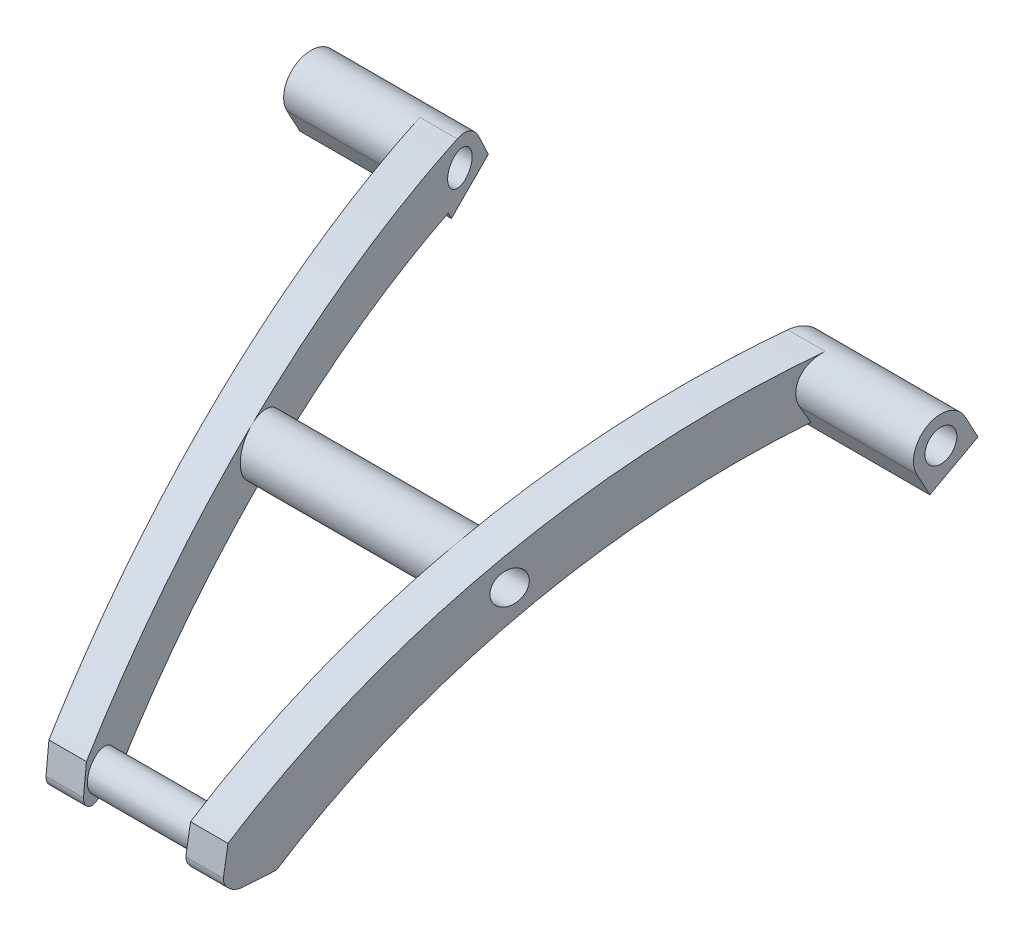
from build123d import *

# Parameters (mm, degrees)
CROQUIS3_R                        = 3
CROQUIS3_R_2                      = 1.75
SALIENTE_EXTRUIR1_DEPTH           = 25
SALIENTE_EXTRUIR1_2_DEPTH         = 25
SALIENTE_EXTRUIR2_DEPTH           = 5
CROQUIS6_R                        = 3
SALIENTE_EXTRUIR3_DEPTH           = 10
CROQUIS7_R                        = 1.75
CORTAR_EXTRUIR1_DEPTH             = 10
SALIENTE_EXTRUIR4_DEPTH           = 35
SALIENTE_EXTRUIR4_DEPTH_BACK      = 4
CORTAR_EXTRUIR2_DEPTH             = 35
CORTAR_EXTRUIR3_DEPTH             = 35
CROQUIS11_R                       = 1.75
CORTAR_EXTRUIR4_DEPTH             = 75.850885973
CHAFL_N1_SIZE                     = 2
REDONDEO2_START                   = -5.0000001
REDONDEO2_DEPTH                   = 10.0000002
CROQUIS15_R                       = 3
CROQUIS15_R_2                     = 1.75
SALIENTE_EXTRUIR7_DEPTH           = 34.5
CORTAR_EXTRUIR6_DEPTH             = 75.850885889
CROQUIS17_W                       = 58.035388513
CROQUIS17_H                       = 46.523798752
CORTAR_EXTRUIR7_DEPTH             = 89.512139195
CROQUIS18_W                       = 44.423903472
CROQUIS18_H                       = 36.103655843
CORTAR_EXTRUIR8_DEPTH             = 69.319773447
CORTAR_EXTRUIR9_REACH             = 58.506
CROQUIS19_W                       = 12.504575714
CROQUIS19_H                       = 15.8167713
CORTAR_EXTRUIR9_DIRECTION_2_REACH = 58.506
CORTAR_EXTRUIR10_DEPTH            = 57.505797104
CORTAR_EXTRUIR10_DEPTH_BACK       = 57.505797104
SALIENTE_EXTRUIR8_START           = 5.604429129
SALIENTE_EXTRUIR8_DEPTH           = 5.209978082
SALIENTE_EXTRUIR8_START_2         = 9
SALIENTE_EXTRUIR8_2_OUTLINE_W     = 8
SALIENTE_EXTRUIR8_2_OUTLINE_H     = 9
SALIENTE_EXTRUIR8_2_DEPTH         = 2.244792929
SALIENTE_EXTRUIR8_START_3         = 15.244792929
SALIENTE_EXTRUIR8_3_OUTLINE_W     = 8
SALIENTE_EXTRUIR8_3_OUTLINE_H     = 9
SALIENTE_EXTRUIR8_3_DEPTH         = 1.755207071
SALIENTE_EXTRUIR9_REACH           = 58.506
CROQUIS27_R                       = 2
SALIENTE_EXTRUIR10_REACH          = 84.241


with BuildPart() as part:
    # Croquis3 → Saliente-Extruir1 (new body)
    with BuildSketch(Plane(origin=(0, 0, 0), x_dir=(0, 0, -1), z_dir=(1, 0, 0))):
        with Locations((0, 20.2)):
            Circle(CROQUIS3_R)
        with Locations((0, 20.2)):
            Circle(CROQUIS3_R_2, mode=Mode.SUBTRACT)
    extrude(amount=SALIENTE_EXTRUIR1_DEPTH)


with BuildPart() as body_2:
    # Croquis3 → Saliente-Extruir1 2 (new body)
    with BuildSketch(Plane(origin=(0, 0, 0), x_dir=(0, 0, -1), z_dir=(1, 0, 0))):
        with Locations((28.402251252, 28.88343963)):
            Circle(CROQUIS3_R)
        with Locations((28.402251252, 28.88343963)):
            Circle(CROQUIS3_R_2, mode=Mode.SUBTRACT)
    extrude(amount=SALIENTE_EXTRUIR1_2_DEPTH)


with BuildPart() as body_3:
    # Croquis5 → Saliente-Extruir2 (new, symmetric)
    with BuildSketch(Plane(origin=(0, 0, 0), x_dir=(1, 0, 0), z_dir=(0, 1, 0))):
        with BuildLine():
            Line((0, -26), (0, -30))
            add(Edge.make_bspline(
                [(0, -30), (3.306526268, -30), (16.53263134, -29.831217065), (35.997648536, -28.565345051), (52.057120801, -26.333176426), (58.766277483, -25.109762555), (60, -24.873829164)],
                knots=[4.71238898, 4.71238898, 4.71238898, 4.71238898, 4.810563751, 5.105088062, 5.301437603, 5.346535107, 5.346535107, 5.346535107, 5.346535107], degree=3))
            Line((60, -24.873829164), (60, -20.8))
            add(Edge.make_bspline(
                [(0, -26), (33.333333333, -26), (60, -20.8)],
                knots=[4.71238898, 4.71238898, 4.71238898, 5.355890089, 5.355890089, 5.355890089], degree=2, weights=[1, 0.948683298, 1]))
        make_face()
    extrude(amount=SALIENTE_EXTRUIR2_DEPTH, both=True)

    # Croquis6 → Saliente-Extruir3 (add)
    with BuildSketch(Plane.XY.offset(26)):
        with Locations((38, 0)):
            Circle(CROQUIS6_R)
    extrude(amount=-SALIENTE_EXTRUIR3_DEPTH)

    # Croquis7 → Cortar-Extruir1 (cut)
    with BuildSketch(Plane(origin=(0, 0, 16), x_dir=(-1, 0, 0), z_dir=(0, 0, -1))):
        with Locations((-38, 0)):
            Circle(CROQUIS7_R)
    extrude(amount=-CORTAR_EXTRUIR1_DEPTH, mode=Mode.SUBTRACT)


with BuildPart() as body_4:
    # Croquis8 → Saliente-Extruir4 (new, two sides: drawn at the far end of the back side and taken through both)
    with BuildSketch(Plane(origin=(0, 0, 0), x_dir=(1, 0, 0), z_dir=(0, 1, 0)).offset(-SALIENTE_EXTRUIR4_DEPTH_BACK)):
        Polygon((18.892070983, 31.402251252), (5, -28), (9.107929017, -28), (23, 31.402251252), align=None)
    extrude(amount=SALIENTE_EXTRUIR4_DEPTH + SALIENTE_EXTRUIR4_DEPTH_BACK)

    # Croquis9 → Cortar-Extruir2 (cut)
    with BuildSketch(Plane(origin=(0, 0, 0), x_dir=(0, 0, -1), z_dir=(1, 0, 0))):
        with BuildLine():
            ThreePointArc((23.072173604, 71.551815183), (-21.61922461, 57.42408075), (-58.358460899, 28.318368742))
            ThreePointArc((-58.358460899, 28.318368742), (-54.318368742, -32.358460899), (6.358460899, -28.318368742))
            ThreePointArc((6.358460899, -28.318368742), (18.708788399, -18.534140443), (33.7323289, -13.784935922))
            ThreePointArc((33.7323289, -13.784935922), (71.070626804, 34.213517278), (23.072173604, 71.551815183))
        make_face()
        with BuildLine():
            ThreePointArc((28.03038537, 31.860303041), (-2.862009257, 22.094675544), (-28.257567039, 1.975700145))
            ThreePointArc((-28.257567039, 1.975700145), (-27.975700145, -2.257567039), (-23.742432961, -1.975700145))
            ThreePointArc((-23.742432961, -1.975700145), (-0.048426954, 16.795264763), (28.774117135, 25.90657622))
            ThreePointArc((28.774117135, 25.90657622), (31.379114663, 29.255305513), (28.03038537, 31.860303041))
        make_face(mode=Mode.SUBTRACT)
    extrude(amount=CORTAR_EXTRUIR2_DEPTH, mode=Mode.SUBTRACT)


with BuildPart() as cortar_extruir3_tool:
    # Croquis10 → Cortar-Extruir3 (new body)
    with BuildSketch(Plane(origin=(0, 0, 0), x_dir=(1, 0, 0), z_dir=(0, 1, 0))):
        Polygon((14.368051869, -5.50780718), (23.738120218, 34.558440326), (28.571984955, 34.558440326), (28.571984955, -5.50780718), align=None)
    extrude(amount=CORTAR_EXTRUIR3_DEPTH)


with BuildPart() as part_1:
    add(part.part)

    # Cortar-Extruir3: cut by cortar_extruir3_tool
    add(cortar_extruir3_tool.part, mode=Mode.SUBTRACT)


with BuildPart() as body_2_1:
    add(body_2.part)

    # Cortar-Extruir3: cut by cortar_extruir3_tool
    add(cortar_extruir3_tool.part, mode=Mode.SUBTRACT)

    # Combinar1: union body 4, part, body 3
    add(body_4.part)
    add(part_1.part)
    add(body_3.part)

    # Croquis11 → Cortar-Extruir4 (cut, through all)
    with BuildSketch(Plane(origin=(0, 0, 0), x_dir=(0, 0, -1), z_dir=(1, 0, 0))):
        with Locations(Location((28.402251252, 28.88343963, 0), (0, 0, 180))):
            Circle(CROQUIS11_R)
        with Locations(Location((0, 20.2, 0), (0, 0, 180))):
            Circle(CROQUIS11_R)
    extrude(amount=CORTAR_EXTRUIR4_DEPTH, mode=Mode.SUBTRACT)

    # Chaflán1
    chafl_n1_edges = [body_2_1.edges().sort_by_distance(p)[0] for p in [
        (60, -5, 22.836914582),
        (60, 5, 22.836914582),
        (30.12007931, -5, 28.805559056),
        (30.12007931, 5, 28.805559056),
    ]]
    chamfer(chafl_n1_edges, length=CHAFL_N1_SIZE)

    # Redondeo2: read off the stored shape, not the designer's step
    # Redondeo2 outline → Redondeo2 (cut)
    with BuildSketch(Plane(origin=(0, 0, 0), x_dir=(1, 0, 0), z_dir=(0, 1, 0)).offset(REDONDEO2_START)):
        with BuildLine():
            Line((60, -24.873829164), (60, -22.378802425))
            ThreePointArc((60, -22.378802425), (59.301153244, -24.303560526), (57.530204169, -25.331577991))
            add(Edge.make_bspline(
                [(57.530204169, -25.331577991), (58.36173126, -25.182267919), (59.185100773, -25.029668046), (60, -24.873829164)],
                knots=[5.316747273, 5.316747273, 5.316747273, 5.316747273, 5.346535107, 5.346535107, 5.346535107, 5.346535107], degree=3))
        make_face()
    extrude(amount=REDONDEO2_DEPTH, mode=Mode.SUBTRACT)

    # Simetría1: body 2 across plane


with BuildPart() as body_2_2:
    add(body_2_1.part)
    add(body_2_1.part.mirror(Plane(origin=(0, 0, 0), x_dir=(0, 0, 1), z_dir=(1, 0, 0))))

    # Croquis15 → Saliente-Extruir7 (add, symmetric)
    with BuildSketch(Plane(origin=(0, 0, 0), x_dir=(0, 0, -1), z_dir=(1, 0, 0))):
        with Locations((28.402251252, 28.88343963)):
            Circle(CROQUIS15_R)
        with Locations((28.402251252, 28.88343963)):
            Circle(CROQUIS15_R_2, mode=Mode.SUBTRACT)
    extrude(amount=SALIENTE_EXTRUIR7_DEPTH, both=True)

    # Croquis16 → Cortar-Extruir6 (cut, through all)
    with BuildSketch(Plane(origin=(0, 0, 0), x_dir=(1, 0, 0), z_dir=(0, 1, 0))):
        Polygon((-16.885477313, 22.822092006), (-19.378773918, 33.483384445), (19.378773918, 33.483384445), (16.885477313, 22.822092006), align=None)
    extrude(amount=CORTAR_EXTRUIR6_DEPTH, mode=Mode.SUBTRACT)

    # Croquis17 → Cortar-Extruir7 (cut, through all)
    with BuildSketch(Plane(origin=(14.844261295, 0, 3.471544045), x_dir=(0.2277199868274214, 0, -0.9737266595915505), z_dir=(0.9737266595915505, 0, 0.2277199868274214))):
        with Locations((-19.202717709, -6.205565874)):
            Rectangle(CROQUIS17_W, CROQUIS17_H)
    extrude(amount=CORTAR_EXTRUIR7_DEPTH, mode=Mode.SUBTRACT)

    # Croquis18 → Cortar-Extruir8 (cut, through all)
    with BuildSketch(Plane(origin=(-14.844261295, 0, 3.471544045), x_dir=(0.2277199868274214, 0, 0.9737266595915505), z_dir=(-0.9737266595915505, 0, 0.2277199868274214))):
        with Locations((24.508189539, -3.279068715)):
            Rectangle(CROQUIS18_W, CROQUIS18_H)
    extrude(amount=CORTAR_EXTRUIR8_DEPTH, mode=Mode.SUBTRACT)

    # Croquis19 → Cortar-Extruir9 (cut, up to next)
    with BuildSketch(Plane(origin=(0, 0, 0), x_dir=(0, 0, -1), z_dir=(1, 0, 0)), mode=Mode.PRIVATE) as cortar_extruir9_sk1:
        with Locations((-31.252287857, 0.477900731)):
            Rectangle(CROQUIS19_W, CROQUIS19_H)
    cortar_extruir9_tool1 = extrude(cortar_extruir9_sk1.sketch, amount=-CORTAR_EXTRUIR9_REACH, mode=Mode.PRIVATE) & body_2_2.part
    add(cortar_extruir9_tool1.solids().sort_by_distance((0, 0.477901, 31.252288))[0], mode=Mode.SUBTRACT)

    # Croquis19 → Cortar-Extruir9 direction 2 (cut, up to next)
    with BuildSketch(Plane(origin=(0, 0, 0), x_dir=(0, 0, -1), z_dir=(1, 0, 0)), mode=Mode.PRIVATE) as cortar_extruir9_direction_2_sk1:
        with Locations((-31.252287857, 0.477900731)):
            Rectangle(CROQUIS19_W, CROQUIS19_H)
    cortar_extruir9_direction_2_tool1 = extrude(cortar_extruir9_direction_2_sk1.sketch, amount=CORTAR_EXTRUIR9_DIRECTION_2_REACH, mode=Mode.PRIVATE) & body_2_2.part
    add(cortar_extruir9_direction_2_tool1.solids().sort_by_distance((0, 0.477901, 31.252288))[0], mode=Mode.SUBTRACT)

    # Croquis22 → Cortar-Extruir10 (cut, two sides: drawn at the far end of the back side and taken through both)
    with BuildSketch(Plane(origin=(0, 0, 0), x_dir=(0, 0, -1), z_dir=(1, 0, 0)).offset(-CORTAR_EXTRUIR10_DEPTH_BACK)):
        Polygon((-25, 5.502584664), (-20.70312925, 1.31487625), (-20.70312925, -4.672126299), (-25.020021016, -4.672126299), align=None)
    extrude(amount=CORTAR_EXTRUIR10_DEPTH + CORTAR_EXTRUIR10_DEPTH_BACK, mode=Mode.SUBTRACT)

    # Saliente-Extruir8: read off the stored shape, not the designer's step
    # Saliente-Extruir8 outline → Saliente-Extruir8 (add)
    with BuildSketch(Plane(origin=(0, 0, 0), x_dir=(0, 0, -1), z_dir=(1, 0, 0)).offset(SALIENTE_EXTRUIR8_START)):
        with BuildLine():
            ThreePointArc((-25.415471242, 2.327351318), (-24.973202481, 1.259620078), (-23.905471242, 0.817351318))
            Line((-23.905471242, 0.817351318), (-20.70312925, 1.31487625))
            Line((-20.70312925, 1.31487625), (-25, 5.502584664))
            Line((-25, 5.502584664), (-25.415471242, 2.327351318))
        make_face()
    extrude(amount=SALIENTE_EXTRUIR8_DEPTH)

    # Saliente-Extruir8 2 outline → Saliente-Extruir8 2 (cut)
    with BuildSketch(Plane(origin=(0, 0, 0), x_dir=(0, 1, 0), z_dir=(0.9737266595915505, 0, 0.22771998682742112)).offset(SALIENTE_EXTRUIR8_START_2)):
        with Locations((3, 20.5)):
            Rectangle(SALIENTE_EXTRUIR8_2_OUTLINE_W, SALIENTE_EXTRUIR8_2_OUTLINE_H)
    extrude(amount=SALIENTE_EXTRUIR8_2_DEPTH, mode=Mode.SUBTRACT)

    # Saliente-Extruir8 3 outline → Saliente-Extruir8 3 (cut)
    with BuildSketch(Plane(origin=(0, 0, 0), x_dir=(0, 1, 0), z_dir=(0.9737266595915505, 0, 0.22771998682742112)).offset(SALIENTE_EXTRUIR8_START_3)):
        with Locations((3, 20.5)):
            Rectangle(SALIENTE_EXTRUIR8_3_OUTLINE_W, SALIENTE_EXTRUIR8_3_OUTLINE_H)
    extrude(amount=SALIENTE_EXTRUIR8_3_DEPTH, mode=Mode.SUBTRACT)

    # Saliente-Extruir9: up to this plane
    saliente_extruir9_end = Plane(origin=(18.892070983, -4, -31.402251252), z_dir=(-0.9737266595915502, 0, -0.22771998682742178))
    # Croquis27 → Saliente-Extruir9 (add, up to the surface)
    with BuildSketch(Plane(origin=(0, 0, 0), x_dir=(0, 0, -1), z_dir=(1, 0, 0)), mode=Mode.PRIVATE) as saliente_extruir9_sk1:
        with Locations(Location((-22.851564625, 3.408730457, 0), (0, 0, 180))):
            Circle(CROQUIS27_R)
    saliente_extruir9_tool1 = split(extrude(saliente_extruir9_sk1.sketch, amount=SALIENTE_EXTRUIR9_REACH, mode=Mode.PRIVATE), bisect_by=saliente_extruir9_end, keep=Keep.BOTH, mode=Mode.PRIVATE)
    add(saliente_extruir9_tool1.solids().sort_by_distance((0, 3.40873, 22.851565))[0])

    # Simetría2: body 2 across plane


with BuildPart() as body_2_3:
    add(body_2_2.part)
    add(body_2_2.part.mirror(Plane(origin=(0, 0, 0), x_dir=(0, 0, 1), z_dir=(1, 0, 0))))

    # Saliente-Extruir10: up to this plane
    saliente_extruir10_end = Plane(origin=(18.892070983, -4, -31.402251252), z_dir=(-0.9737266595915502, 0, -0.22771998682742178))
    # Croquis28 → Saliente-Extruir10 (add, up to the surface)
    with BuildSketch(Plane(origin=(34.5, 0, 0), x_dir=(0, 0, -1), z_dir=(1, 0, 0)), mode=Mode.PRIVATE) as saliente_extruir10_sk1:
        with BuildLine():
            ThreePointArc((27.066737846, 26.197103102), (26.31824017, 26.725454966), (25.764112295, 27.455075937))
            Line((25.764112295, 27.455075937), (27.191957483, 24.81789464))
            Line((27.191957483, 24.81789464), (29.759019258, 26.207775119))
            ThreePointArc((29.759019258, 26.207775119), (28.41414295, 25.883463199), (27.066737846, 26.197103102))
        make_face()
    saliente_extruir10_tool1 = split(extrude(saliente_extruir10_sk1.sketch, amount=-SALIENTE_EXTRUIR10_REACH, mode=Mode.PRIVATE), bisect_by=saliente_extruir10_end, keep=Keep.BOTH, mode=Mode.PRIVATE)
    add(saliente_extruir10_tool1.solids().sort_by_distance((34.5, 25.725607, -27.460996))[0])
    # Croquis28 → Saliente-Extruir10 (add, up to the surface)
    with BuildSketch(Plane(origin=(34.5, 0, 0), x_dir=(0, 0, -1), z_dir=(1, 0, 0)), mode=Mode.PRIVATE) as saliente_extruir10_sk2:
        with BuildLine():
            Line((28.972595635, 27.22898888), (27.066737846, 26.197103102))
            ThreePointArc((27.066737846, 26.197103102), (28.41414295, 25.883463199), (29.759019258, 26.207775119))
            Line((29.759019258, 26.207775119), (29.901173624, 26.284741548))
            ThreePointArc((29.901173624, 26.284741548), (30.907879247, 27.233643172), (31.381757368, 28.533377772))
            Line((31.381757368, 28.533377772), (29.475899579, 27.501491994))
            ThreePointArc((29.475899579, 27.501491994), (29.235463407, 27.344525238), (28.972595635, 27.22898888))
        make_face()
    saliente_extruir10_tool2 = split(extrude(saliente_extruir10_sk2.sketch, amount=-SALIENTE_EXTRUIR10_REACH, mode=Mode.PRIVATE), bisect_by=saliente_extruir10_end, keep=Keep.BOTH, mode=Mode.PRIVATE)
    add(saliente_extruir10_tool2.solids().sort_by_distance((34.5, 26.907055, -29.472322))[0])
    # Croquis28 → Saliente-Extruir10 (add, up to the surface)
    with BuildSketch(Plane(origin=(34.5, 0, 0), x_dir=(0, 0, -1), z_dir=(1, 0, 0)), mode=Mode.PRIVATE) as saliente_extruir10_sk3:
        with BuildLine():
            Line((32.468235398, 27.674622027), (31.04039021, 30.311803324))
            ThreePointArc((31.04039021, 30.311803324), (31.310379247, 29.620183523), (31.402251252, 28.88343963))
            ThreePointArc((31.402251252, 28.88343963), (31.397123399, 28.708109011), (31.381757368, 28.533377772))
            ThreePointArc((31.381757368, 28.533377772), (30.907879247, 27.233643172), (29.901173624, 26.284741548))
            Line((29.901173624, 26.284741548), (32.468235398, 27.674622027))
        make_face()
    saliente_extruir10_tool3 = split(extrude(saliente_extruir10_sk3.sketch, amount=-SALIENTE_EXTRUIR10_REACH, mode=Mode.PRIVATE), bisect_by=saliente_extruir10_end, keep=Keep.BOTH, mode=Mode.PRIVATE)
    add(saliente_extruir10_tool3.solids().sort_by_distance((34.5, 27.945505, -31.561072))[0])

    # Simetría3: body 2 across plane


with BuildPart() as body_2_4:
    add(body_2_3.part)
    add(body_2_3.part.mirror(Plane(origin=(0, 0, 0), x_dir=(0, 0, 1), z_dir=(1, 0, 0))))


solid = body_2_4.part
